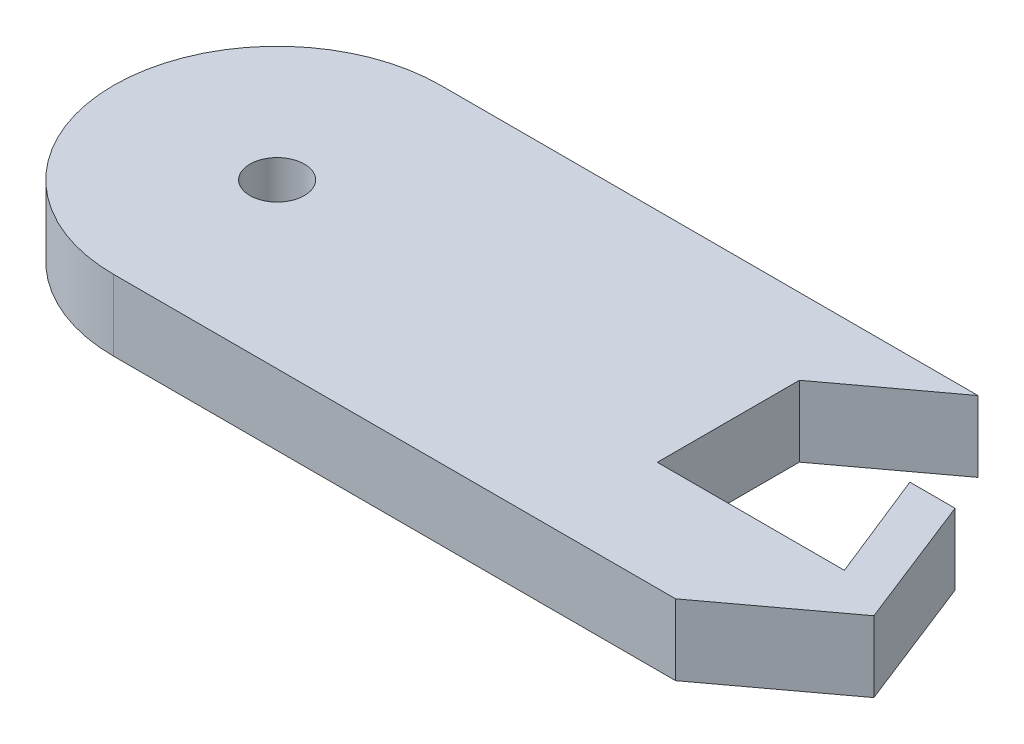
from build123d import *

# Parameters (mm, degrees)
SKETCH1_W           = 80
SKETCH1_H           = 30
BOSS_EXTRUDE1_DEPTH = 6.5
FILLET1_R           = 15
CUT_EXTRUDE1_REACH  = 87.687
SKETCH2_R           = 2.5
CUT_EXTRUDE2_DEPTH  = 86.686930159
CUT_EXTRUDE3_REACH  = 87.687
CUT_EXTRUDE4_DEPTH  = 86.686930159


with BuildPart() as part:
    # Sketch1 → Boss-Extrude1 (new body)
    with BuildSketch(Plane(origin=(0, 0, 0), x_dir=(1, 0, 0), z_dir=(0, 1, 0))):
        with Locations((40, 15)):
            Rectangle(SKETCH1_W, SKETCH1_H)
    extrude(amount=BOSS_EXTRUDE1_DEPTH)

    # Fillet1
    fillet1_edges = [part.edges().sort_by_distance(p)[0] for p in [
        (0, 3.25, 0),
        (0, 3.25, -30),
    ]]
    fillet(fillet1_edges, radius=FILLET1_R - 0.0001)  # a hair under: the kernel refuses the full size

    # Sketch2 → Cut-Extrude1 (cut, up to next)
    with BuildSketch(Plane(origin=(0, 6.5, 0), x_dir=(1, 0, 0), z_dir=(0, 1, 0)), mode=Mode.PRIVATE) as cut_extrude1_sk1:
        with Locations(Location((15, 15, 0), (0, 0, 270))):
            Circle(SKETCH2_R)
    cut_extrude1_tool1 = extrude(cut_extrude1_sk1.sketch, amount=-CUT_EXTRUDE1_REACH, mode=Mode.PRIVATE) & part.part
    add(cut_extrude1_tool1.solids().sort_by_distance((15, 6.5, -15))[0], mode=Mode.SUBTRACT)

    # Sketch3 → Cut-Extrude2 (cut, through all)
    with BuildSketch(Plane(origin=(0, 6.5, 0), x_dir=(1, 0, 0), z_dir=(0, 1, 0))):
        Polygon((68, 20), (72, 10), (54.850407656, 10), (54.850407656, 23.025538444), (64.248213181, 30), (80, 30), (80, 20), align=None)
    extrude(amount=-CUT_EXTRUDE2_DEPTH, mode=Mode.SUBTRACT)

    # Sketch4 → Cut-Extrude3 (cut, up to next)
    with BuildSketch(Plane(origin=(0, 6.5, 0), x_dir=(1, 0, 0), z_dir=(0, 1, 0)), mode=Mode.PRIVATE) as cut_extrude3_sk1:
        Polygon((80, 20), (80, 0), (72.147195496, 20), align=None)
    cut_extrude3_tool1 = extrude(cut_extrude3_sk1.sketch, amount=-CUT_EXTRUDE3_REACH, mode=Mode.PRIVATE) & part.part
    add(cut_extrude3_tool1.solids().sort_by_distance((77.382398, 6.5, -13.333333))[0], mode=Mode.SUBTRACT)

    # Sketch5 → Cut-Extrude4 (cut, through all)
    with BuildSketch(Plane(origin=(0, 6.5, 0), x_dir=(1, 0, 0), z_dir=(0, 1, 0))):
        Polygon((80, 0), (80, 10), (66.525403502, 0), align=None)
    extrude(amount=-CUT_EXTRUDE4_DEPTH, mode=Mode.SUBTRACT)


solid = part.part
